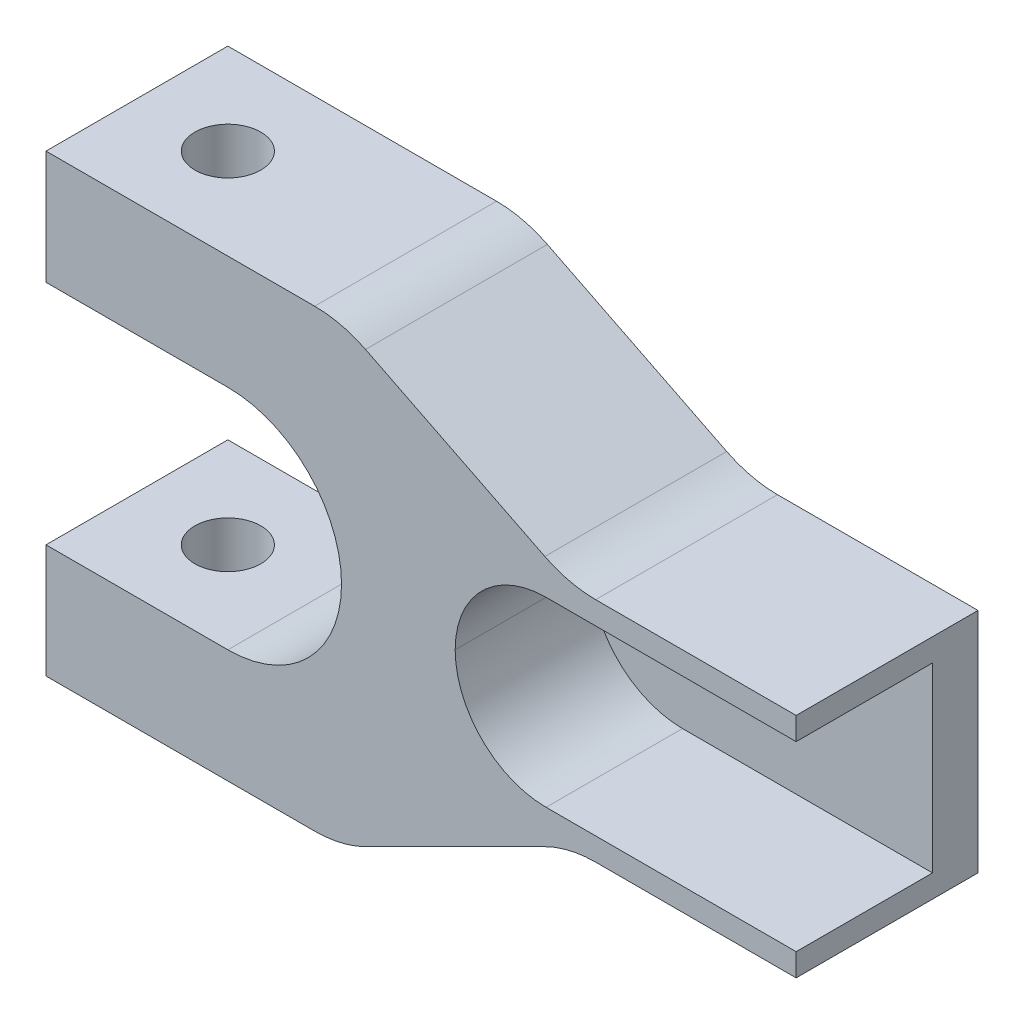
from build123d import *

# Parameters (mm, degrees)
BOSS_EXTRUDE1_DEPTH = 4
SKETCH3_W           = 6
SKETCH3_H           = 8
CUT_EXTRUDE1_DEPTH  = 15
FILLET1_R           = 4
SKETCH4_R           = 1.25
CUT_EXTRUDE2_DEPTH  = 23.090722034
FILLET2_R           = 5
FILLET3_R           = 5
SKETCH6_R           = 1.45
CUT_EXTRUDE3_DEPTH  = 28.202941017


with BuildPart() as part:
    # Sketch1 → Boss-Extrude1 (new, symmetric)
    with BuildSketch(Plane.XY):
        Polygon((15, 5), (15, -5), (5, -5), (-5, -10), (-18, -10), (-18, -5), (-5, -5), (-5, 5), (-18, 5), (-18, 10), (-5, 10), (5, 5), align=None)
    extrude(amount=BOSS_EXTRUDE1_DEPTH, both=True)

    # Sketch3 → Cut-Extrude1 (cut)
    with BuildSketch(Plane(origin=(15, 0, 0), x_dir=(0, 0, -1), z_dir=(1, 0, 0))):
        with Locations((-1, 0)):
            Rectangle(SKETCH3_W, SKETCH3_H)
    extrude(amount=-CUT_EXTRUDE1_DEPTH, mode=Mode.SUBTRACT)

    # Fillet1
    fillet1_edges = [part.edges().sort_by_distance(p)[0] for p in [
        (0, -4, 1),
        (0, 4, 1),
    ]]
    fillet(fillet1_edges, radius=FILLET1_R - 0.0001)  # a hair under: the kernel refuses the full size

    # Sketch4 → Cut-Extrude2 (cut, through all)
    with BuildSketch(Plane(origin=(0, 0, -4), x_dir=(-1, 0, 0), z_dir=(0, 0, -1))):
        with Locations((-4, 0)):
            Circle(SKETCH4_R)
        with Locations((-8, 0)):
            Circle(SKETCH4_R)
    extrude(amount=-CUT_EXTRUDE2_DEPTH, mode=Mode.SUBTRACT)

    # Fillet2
    fillet2_edges = [part.edges().sort_by_distance(p)[0] for p in [
        (-5, 5, 0),
        (-5, -5, 0),
    ]]
    fillet(fillet2_edges, radius=FILLET2_R - 0.0001)  # a hair under: the kernel refuses the full size

    # Fillet3
    fillet3_edges = [part.edges().sort_by_distance(p)[0] for p in [
        (-5, 10, 0),
        (5, 5, 0),
        (5, -5, 0),
        (-5, -10, 0),
    ]]
    fillet(fillet3_edges, radius=FILLET3_R)

    # Sketch6 → Cut-Extrude3 (cut, through all)
    with BuildSketch(Plane(origin=(0, 10, 0), x_dir=(1, 0, 0), z_dir=(0, 1, 0))):
        with Locations(Location((-14, 0, 0), (0, 0, 180))):
            Circle(SKETCH6_R)
    extrude(amount=-CUT_EXTRUDE3_DEPTH, mode=Mode.SUBTRACT)


solid = part.part
